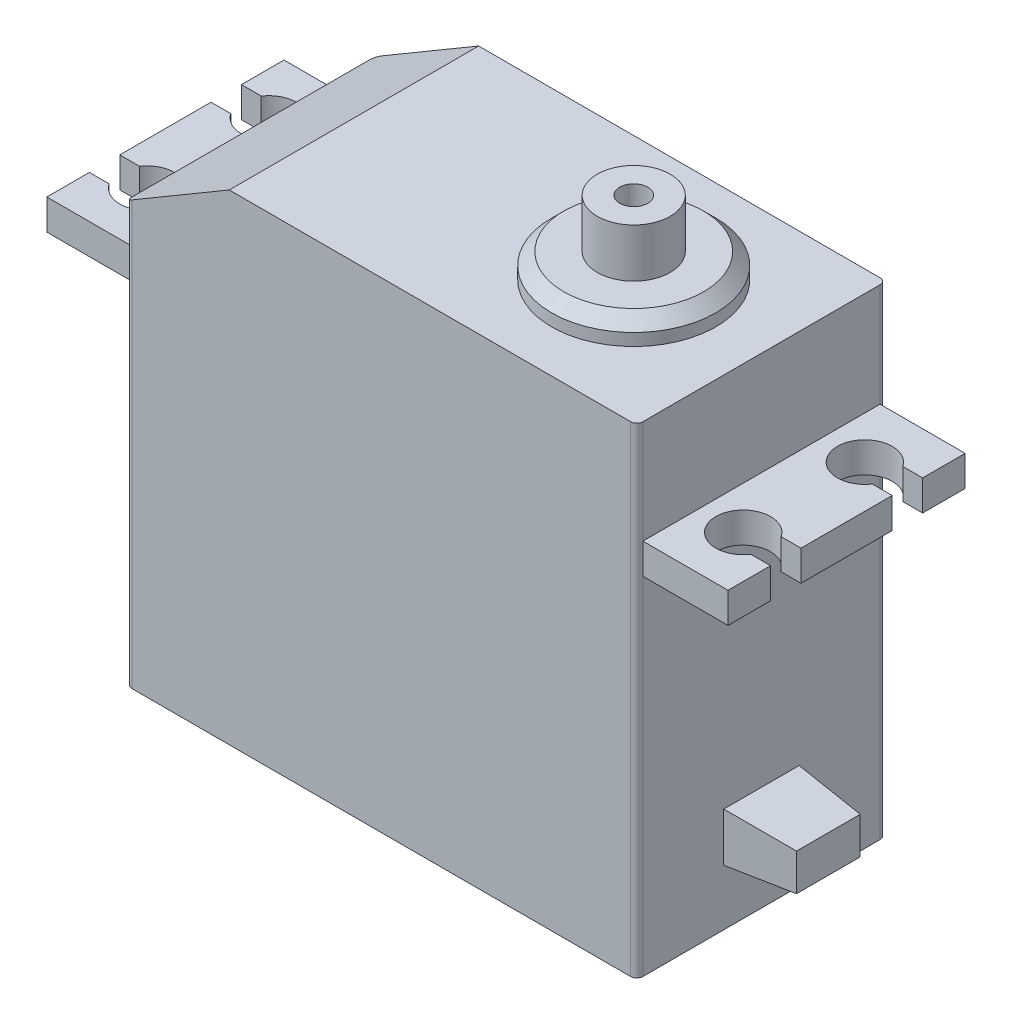
from build123d import *

# Parameters (mm, degrees)
SKETCH1_W            = 42
SKETCH1_H            = 20.5
BOSS_EXTRUDE1_DEPTH  = 39.5
BOSS_EXTRUDE2_START  = -0.5
SKETCH2_W            = 56
SKETCH2_H            = 2.5
BOSS_EXTRUDE2_DEPTH  = 19.5
CUT_EXTRUDE1_DEPTH   = 40
MIRROR2_COPY_1_DEPTH = 40
CUT_EXTRUDE2_DEPTH   = 40
SKETCH5_R            = 3
BOSS_EXTRUDE3_DEPTH  = 6
SKETCH6_R            = 6.75
BOSS_EXTRUDE4_DEPTH  = 2
SKETCH7_R            = 1.15
CUT_EXTRUDE3_DEPTH   = 5
FILLET1_R            = 0.5
SKETCH8_W            = 6.2
SKETCH8_H            = 4
BOSS_EXTRUDE5_DEPTH  = 5.5
BOSS_EXTRUDE5_TAPER  = 5
CHAMFER1_SIZE        = 1


with BuildPart() as part:
    # Sketch1 → Boss-Extrude1 (new body)
    with BuildSketch(Plane(origin=(0, 0, 0), x_dir=(1, 0, 0), z_dir=(0, 1, 0))):
        Rectangle(SKETCH1_W, SKETCH1_H)
    extrude(amount=BOSS_EXTRUDE1_DEPTH)

    # Sketch2 → Boss-Extrude2 (add)
    with BuildSketch(Plane.XY.offset(10.25).offset(BOSS_EXTRUDE2_START)):
        with Locations((0, 29.75)):
            Rectangle(SKETCH2_W, SKETCH2_H)
    extrude(amount=-BOSS_EXTRUDE2_DEPTH)

    # Sketch3 → Cut-Extrude1 (cut)
    with BuildSketch(Plane(origin=(0, 31, 0), x_dir=(1, 0, 0), z_dir=(0, 1, 0))):
        with BuildLine():
            Line((26.370828693, 3.75), (28, 3.75))
            Line((28, 3.75), (28, 6.25))
            Line((28, 6.25), (26.370828693, 6.25))
            ThreePointArc((26.370828693, 6.25), (22.25, 5), (26.370828693, 3.75))
        make_face()
    cut_extrude1 = extrude(amount=-CUT_EXTRUDE1_DEPTH, mode=Mode.SUBTRACT)

    # Mirror1: Cut-Extrude1 across plane
    add(cut_extrude1.mirror(Plane.XY), mode=Mode.SUBTRACT)

    # Mirror2: Cut-Extrude1 across plane
    add(cut_extrude1.mirror(Plane(origin=(0, 0, 0), x_dir=(0, 0, 1), z_dir=(1, 0, 0))), mode=Mode.SUBTRACT)

    # Mirror2 copy 1 sketch → Mirror2 copy 1 (cut)
    with BuildSketch(Plane(origin=(0, 31, 0), x_dir=(-1, 0, 0), z_dir=(0, 1, 0))):
        with BuildLine():
            Line((26.370828693, 3.75), (28, 3.75))
            Line((28, 3.75), (28, 6.25))
            Line((28, 6.25), (26.370828693, 6.25))
            ThreePointArc((26.370828693, 6.25), (22.25, 5), (26.370828693, 3.75))
        make_face()
    extrude(amount=-MIRROR2_COPY_1_DEPTH, mode=Mode.SUBTRACT)

    # Sketch4 → Cut-Extrude2 (cut)
    with BuildSketch(Plane.XY.offset(10.25)):
        Polygon((-21, 34.5), (-12.5, 39.5), (-12.5, 42.326326537), (-24.476884638, 42.326326537), (-24.476884638, 34.5), align=None)
    extrude(amount=-CUT_EXTRUDE2_DEPTH, mode=Mode.SUBTRACT)

    # Sketch5 → Boss-Extrude3 (add)
    with BuildSketch(Plane(origin=(0, 39.5, 0), x_dir=(1, 0, 0), z_dir=(0, 1, 0))):
        with Locations(Location((10.5, 0, 0), (0, 0, 90))):
            Circle(SKETCH5_R)
    extrude(amount=BOSS_EXTRUDE3_DEPTH)

    # Sketch6 → Boss-Extrude4 (add)
    with BuildSketch(Plane(origin=(0, 39.5, 0), x_dir=(1, 0, 0), z_dir=(0, 1, 0))):
        with Locations(Location((10.5, 0, 0), (0, 0, 90))):
            Circle(SKETCH6_R)
    extrude(amount=BOSS_EXTRUDE4_DEPTH)

    # Sketch7 → Cut-Extrude3 (cut)
    with BuildSketch(Plane(origin=(0, 45.5, 0), x_dir=(1, 0, 0), z_dir=(0, 1, 0))):
        with Locations(Location((10.5, 0, 0), (0, 0, 270))):
            Circle(SKETCH7_R)
    extrude(amount=-CUT_EXTRUDE3_DEPTH, mode=Mode.SUBTRACT)

    # Fillet1
    fillet1_edges = [part.edges().sort_by_distance(p)[0] for p in [
        (-21, 17.25, -10.25),
        (-21, 17.25, 10.25),
        (21, 19.75, -10.25),
        (21, 19.75, 10.25),
    ]]
    fillet(fillet1_edges, radius=FILLET1_R - 0.0001)  # a hair under: the kernel refuses the full size

    # Sketch8 → Boss-Extrude5 (add)
    with BuildSketch(Plane(origin=(21, 0, 0), x_dir=(0, 0, -1), z_dir=(1, 0, 0))):
        with Locations((0, 6.6)):
            Rectangle(SKETCH8_W, SKETCH8_H)
    extrude(amount=BOSS_EXTRUDE5_DEPTH, taper=BOSS_EXTRUDE5_TAPER)

    # Chamfer1
    chamfer1_edges = [part.edges().sort_by_distance(p)[0] for p in [
        (10.5, 41.5, 6.75),
    ]]
    chamfer(chamfer1_edges, length=CHAMFER1_SIZE)


solid = part.part
